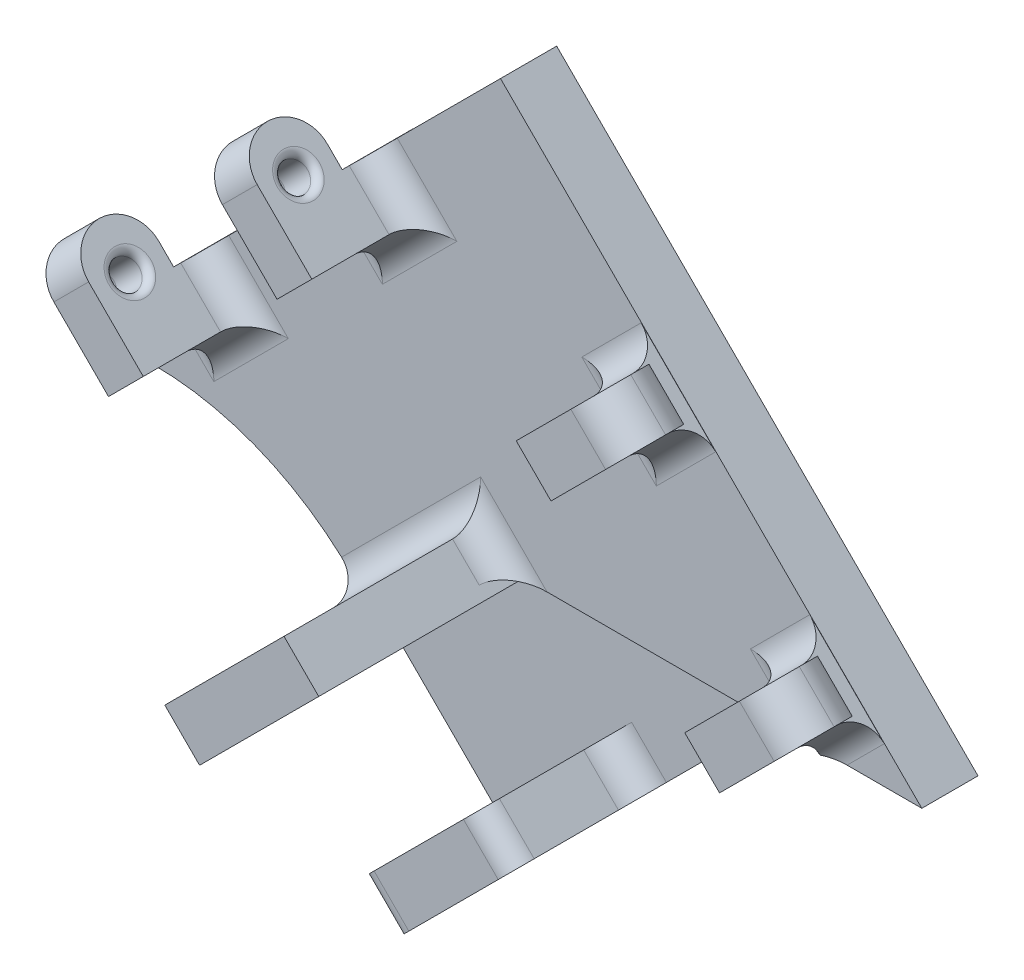
from build123d import *

# Parameters (mm, degrees)
BOSS_EXTRUDE1_DEPTH   = 4
BOSS_EXTRUDE2_START   = -4
BOSS_EXTRUDE2_DEPTH   = 13
BOSS_EXTRUDE3_START   = 2.5
BOSS_EXTRUDE3_DEPTH   = 5
BOSS_EXTRUDE3_2_DEPTH = 5
BOSS_EXTRUDE3_3_DEPTH = 5
BOSS_EXTRUDE3_4_DEPTH = 5
BOSS_EXTRUDE4_DEPTH   = 10
SKETCH6_R             = 1
CUT_EXTRUDE5_DEPTH    = 25
SKETCH7_R             = 1
CUT_EXTRUDE6_DEPTH    = 25
FILLET2_R             = 2.5
CUT_EXTRUDE8_DEPTH    = 9.5
SKETCH11_R            = 1
CUT_EXTRUDE9_DEPTH    = 20
FILLET3_R             = 20
BOSS_EXTRUDE5_DEPTH   = 5
BOSS_EXTRUDE6_DEPTH   = 3.5
SKETCH15_R            = 1.9
CUT_EXTRUDE10_DEPTH   = 1
FILLET5_R             = 0.5
FILLET6_R             = 0.5
FILLET7_R             = 2
FILLET8_R             = 1.5


# Some blends are built 0.0001 mm under size
with BuildPart() as part:
    # Sketch1 → Boss-Extrude1 (new body)
    with BuildSketch(Plane.XY):
        Polygon((-30, 0), (30, 0), (0, 30), align=None)
    extrude(amount=BOSS_EXTRUDE1_DEPTH)

    # Sketch2 → Boss-Extrude2 (add)
    with BuildSketch(Plane.XY.offset(4).offset(BOSS_EXTRUDE2_START)):
        Polygon((1.414213562, -17.899494937), (-9.899494937, -6.585786438), (-1.414213562, 1.899494937), (9.899494937, -9.414213562), align=None)
    extrude(amount=BOSS_EXTRUDE2_DEPTH)



with BuildPart() as body_2:
    # Sketch5 → Boss-Extrude3 (new body)
    with BuildSketch(Plane.XY.offset(4).offset(BOSS_EXTRUDE3_START)):
        Polygon((-8.409009742, 15.934136008), (-14.065863992, 21.590990258), (-11.590990258, 24.065863992), (-5.934136008, 18.409009742), align=None)
    extrude(amount=BOSS_EXTRUDE3_DEPTH)


with BuildPart() as body_3:
    # Sketch5 → Boss-Extrude3 2 (new body)
    with BuildSketch(Plane.XY.offset(4).offset(BOSS_EXTRUDE3_START)):
        Polygon((-20.409009742, 3.934136008), (-26.065863992, 9.590990258), (-23.590990258, 12.065863992), (-17.934136008, 6.409009742), align=None)
    extrude(amount=BOSS_EXTRUDE3_2_DEPTH)


with BuildPart() as body_4:
    # Sketch5 → Boss-Extrude3 3 (new body)
    with BuildSketch(Plane.XY.offset(4).offset(BOSS_EXTRUDE3_START)):
        Polygon((8.621141777, 15.722003974), (14.277996026, 21.378858223), (16.75286976, 18.903984489), (11.096015511, 13.24713024), align=None)
    extrude(amount=BOSS_EXTRUDE3_3_DEPTH)


with BuildPart() as body_5:
    # Sketch5 → Boss-Extrude3 4 (new body)
    with BuildSketch(Plane.XY.offset(4).offset(BOSS_EXTRUDE3_START)):
        Polygon((20.621141777, 3.722003974), (26.277996026, 9.378858223), (28.75286976, 6.903984489), (23.096015511, 1.24713024), align=None)
    extrude(amount=BOSS_EXTRUDE3_4_DEPTH)


with BuildPart() as part_1:
    add(part.part)

    add(body_2.part)  # Boss-Extrude4 merges body 2

    add(body_3.part)  # Boss-Extrude4 merges body 3

    add(body_4.part)  # Boss-Extrude4 merges body 4

    add(body_5.part)  # Boss-Extrude4 merges body 5
    # Sketch8 → Boss-Extrude4 (add)
    with BuildSketch(Plane.XY.offset(11.5)):
        Polygon((-20.409009742, 3.934136008), (-17.934136008, 6.409009742), (-20.77228069, 9.247154424), (-23.247154424, 6.77228069), align=None)
        Polygon((-8.409009742, 15.934136008), (-5.934136008, 18.409009742), (-8.770090905, 21.24496464), (-11.24496464, 18.770090905), align=None)
        Polygon((8.621141777, 15.722003974), (11.096015511, 13.24713024), (13.908555635, 16.059670364), (11.433681901, 18.534544098), align=None)
        Polygon((23.096015511, 1.24713024), (20.621141777, 3.722003974), (23.433669477, 6.534531674), (25.908543211, 4.05965794), align=None)
    extrude(amount=-BOSS_EXTRUDE4_DEPTH)

    # Sketch6 → Cut-Extrude5 (cut)
    with BuildSketch(Plane(origin=(10.924442636, -10.924442636, 0), x_dir=(0.7071067811865506, 0.7071067811865446, 0), z_dir=(0.7071067811865446, -0.7071067811865506, 0))):
        with Locations((22.098203436, 9)):
            Circle(SKETCH6_R)
    extrude(amount=-CUT_EXTRUDE5_DEPTH, mode=Mode.SUBTRACT)

    # Sketch7 → Cut-Extrude6 (cut)
    with BuildSketch(Plane(origin=(-8.237436867, -8.237436867, 0), x_dir=(0, 0, 1), z_dir=(-0.7071067811865501, -0.7071067811865449, 0))):
        with Locations(Location((9, 22.098203436, 0), (0, 0, 270))):
            Circle(SKETCH7_R)
    extrude(amount=-CUT_EXTRUDE6_DEPTH, mode=Mode.SUBTRACT)

    # Fillet2
    fillet2_edges = [part_1.edges().sort_by_distance(p)[0] for p in [
        (15.515432893, 20.141421356, 11.5),
        (15.515432893, 20.141421356, 6.5),
        (27.515432893, 8.141421356, 6.5),
        (27.515432893, 8.141421356, 11.5),
        (-24.828427125, 10.828427125, 6.5),
        (-12.828427125, 22.828427125, 6.5),
        (-12.828427125, 22.828427125, 11.5),
        (-24.828427125, 10.828427125, 11.5),
    ]]
    fillet(fillet2_edges, radius=FILLET2_R - 0.0001)  # a hair under: the kernel refuses the full size

    # Sketch10 → Cut-Extrude8 (cut)
    with BuildSketch(Plane.XY.offset(13)):
        Polygon((-7.424621202, -9.060660172), (-1.060660172, -15.424621202), (7.424621202, -6.939339828), (1.060660172, -0.575378798), align=None)
    extrude(amount=-CUT_EXTRUDE8_DEPTH, mode=Mode.SUBTRACT)

    # Sketch11 → Cut-Extrude9 (cut)
    with BuildSketch(Plane(origin=(9.656854249, -9.656854249, 0), x_dir=(0, 0, -1), z_dir=(0.7071067811865464, -0.7071067811865487, 0))):
        with Locations(Location((-9, -5.656854249, 0), (0, 0, 90))):
            Circle(SKETCH11_R)
    extrude(amount=-CUT_EXTRUDE9_DEPTH, mode=Mode.SUBTRACT)

    # Fillet3
    # the kernel refuses this fillet: 20 mm, written as the material it adds along each edge
    with BuildSketch(Plane(origin=(-3.313708499, 0, 0), x_dir=(-0.7071067811865843, -0.7071067811865105, 0), z_dir=(0, 0, 1))) as fillet3_piece_1:
        with BuildLine():
            CenterArc((29.288481627, -1.004210379), FILLET3_R, 177.121938999, 47.878061001)
            Line((15.146346003, -15.146346003), (14.863503291, -15.429188716))
            Line((14.863503291, -15.429188716), (-0.282842712, -0.282842712))
            Line((-0.282842712, -0.282842712), (0, 0.4))
            ThreePointArc((0, 0.4), (4.656854249, 0.4), (8.914213036, 0.020084208))
            Line((8.914213036, 0.020084208), (9.313708499, 0))
        make_face()
    extrude(amount=4)

    # Sketch13 → Boss-Extrude5 (add)
    with BuildSketch(Plane.XY.offset(13)):
        Polygon((-1.414213562, 1.899494937), (-9.899494937, -6.585786438), (-7.424621202, -9.060660172), (1.060660172, -0.575378798), align=None)
    extrude(amount=BOSS_EXTRUDE5_DEPTH)

    # Sketch14 → Boss-Extrude6 (add)
    with BuildSketch(Plane.XY.offset(3.5)):
        Polygon((0.485281374, 0), (9.899494937, -9.414213562), (19.313708499, 0), align=None)
    extrude(amount=-BOSS_EXTRUDE6_DEPTH)

    # Sketch15 → Cut-Extrude10 (cut)
    with BuildSketch(Plane(origin=(9.656854249, -9.656854249, 0), x_dir=(0, 0, -1), z_dir=(0.7071067811865464, -0.7071067811865487, 0))):
        with Locations(Location((-9, -5.656854249, 0), (0, 0, 90))):
            Circle(SKETCH15_R)
    extrude(amount=-CUT_EXTRUDE10_DEPTH, mode=Mode.SUBTRACT)

    # Fillet5
    fillet5_edges = [part_1.edges().sort_by_distance(p)[0] for p in [
        (-3.889087297, -5.525126266, 9),
        (-6.363961031, -3.050252532, 9),
    ]]
    fillet(fillet5_edges, radius=FILLET5_R)

    # Fillet6
    fillet6_edges = [part_1.edges().sort_by_distance(p)[0] for p in [
        (11.368251622, 18.469113819, 9),
        (23.368251622, 6.469113819, 9),
        (13.843125356, 15.994240085, 9),
        (25.843125356, 3.994240085, 9),
        (-12.57033315, 20.095459415, 9),
        (-22.095459415, 10.57033315, 9),
        (-10.095459415, 22.57033315, 9),
        (-24.57033315, 8.095459415, 9),
        (2.474873734, -11.889087297, 9),
    ]]
    fillet(fillet6_edges, radius=FILLET6_R)

    # Fillet7
    # the kernel refuses this fillet: 2 mm, written as the material it adds along each edge
    with BuildSketch(Plane(origin=(20.621141777, 3.722003974, 4), x_dir=(-0.7071067811865442, 0.7071067811865509, 0), z_dir=(0.7071067811865508, 0.7071067811865442, 0))) as fillet7_piece_1:
        with BuildLine():
            CenterArc((FILLET7_R, FILLET7_R), FILLET7_R, 180, 90)
            Line((0, FILLET7_R), (0, 0))
            Line((0, 0), (FILLET7_R, 0))
        make_face()
    extrude(amount=3.977514818)
    with BuildSketch(Plane(origin=(23.096015511, 1.24713024, 4), x_dir=(-0.7071067811865508, -0.7071067811865444, 0), z_dir=(-0.7071067811865444, 0.7071067811865508, 0))) as fillet7_piece_2_section:
        with BuildLine():
            CenterArc((FILLET7_R, FILLET7_R), FILLET7_R, 180, 90)
            Line((0, FILLET7_R), (0, 0))
            Line((0, 0), (FILLET7_R, 0))
        make_face()
    fillet7_piece_2 = extrude(amount=3.5, mode=Mode.PRIVATE)
    fillet7_piece_2 = split(fillet7_piece_2, bisect_by=Plane(origin=(21.538358904, 0, 4.452946363), z_dir=(0, 1, 0)), keep=Keep.TOP, mode=Mode.PRIVATE)
    add(fillet7_piece_2)
    with BuildSketch(Plane(origin=(25.908543211, 4.05965794, 4), x_dir=(0.7071067811865442, -0.7071067811865509, 0), z_dir=(-0.7071067811865509, -0.7071067811865442, 0))) as fillet7_piece_3_section:
        with BuildLine():
            CenterArc((FILLET7_R, FILLET7_R), FILLET7_R, 180, 90)
            Line((0, FILLET7_R), (0, 0))
            Line((0, 0), (FILLET7_R, 0))
        make_face()
    fillet7_piece_3 = extrude(amount=3.977514818, mode=Mode.PRIVATE)
    fillet7_piece_3 = split(fillet7_piece_3, bisect_by=Plane(origin=(24.822542442, 0, 4.452927613), z_dir=(0, 1, 0)), keep=Keep.TOP, mode=Mode.PRIVATE)
    add(fillet7_piece_3)
    with BuildSketch(Plane(origin=(4.02081528, -3.535533906, 4), x_dir=(0, 0, 1), z_dir=(-0.7071067811865462, 0.7071067811865489, 0))) as fillet7_piece_4_section:
        with BuildLine():
            CenterArc((FILLET7_R, FILLET7_R), FILLET7_R, 180, 90)
            Line((0, FILLET7_R), (0, 0))
            Line((0, 0), (FILLET7_R, 0))
        make_face()
    fillet7_piece_4 = extrude(amount=7.686291501, mode=Mode.PRIVATE)
    fillet7_piece_4 = split(fillet7_piece_4, bisect_by=Plane(origin=(2.268861346, 0, 4.037443885), z_dir=(0, 1, 0)), keep=Keep.TOP, mode=Mode.PRIVATE)
    add(fillet7_piece_4)
    with BuildSketch(Plane(origin=(-9.899494937, -6.585786438, 4), x_dir=(0, 0, 1), z_dir=(0.7071067811865712, 0.707106781186524, 0))) as fillet7_piece_5_section:
        with BuildLine():
            CenterArc((FILLET7_R, -FILLET7_R), FILLET7_R, 90, 90)
            Line((0, -FILLET7_R), (0, 0))
            Line((0, 0), (FILLET7_R, 0))
        make_face()
    fillet7_piece_5 = extrude(amount=12, mode=Mode.PRIVATE)
    fillet7_piece_5 = fillet7_piece_5 - Plane(origin=(-24.733876437, -20, 4.452977165), x_dir=(-0.7071067811865476, -0.7071067811865476, 0), z_dir=(0, 0, -1)) * Cylinder(20, 33, mode=Mode.PRIVATE)
    add(fillet7_piece_5)
    with BuildSketch(Plane(origin=(-20.409009742, 3.934136008, 4), x_dir=(0.7071067811865449, -0.7071067811865502, 0), z_dir=(0.7071067811865502, 0.7071067811865448, 0)), Plane(origin=(-8.409009742, 15.934136008, 4), x_dir=(0.7071067811865444, -0.7071067811865508, 0), z_dir=(0.7071067811865507, 0.7071067811865444, 0)), Plane(origin=(8.621141777, 15.722003974, 4), x_dir=(-0.7071067811865503, -0.7071067811865448, 0), z_dir=(0.7071067811865448, -0.7071067811865503, 0))) as fillet7_piece_6:
        with BuildLine():
            CenterArc((FILLET7_R, -FILLET7_R), FILLET7_R, 90, 90)
            Line((0, -FILLET7_R), (0, 0))
            Line((0, 0), (FILLET7_R, 0))
        make_face()
    extrude(amount=3.5)
    with BuildSketch(Plane(origin=(-23.237436867, 6.762563133, 4), x_dir=(-0.7071067811865498, -0.7071067811865454, 0), z_dir=(0.7071067811865452, -0.7071067811865498, 0)), Plane(origin=(-17.934136008, 6.409009742, 4), x_dir=(0.7071067811865507, 0.7071067811865445, 0), z_dir=(-0.7071067811865445, 0.7071067811865507, 0)), Plane(origin=(-11.237436867, 18.762563133, 4), x_dir=(-0.7071067811865507, -0.7071067811865445, 0), z_dir=(0.7071067811865445, -0.7071067811865507, 0)), Plane(origin=(-5.934136008, 18.409009742, 4), x_dir=(0.7071067811865506, 0.7071067811865446, 0), z_dir=(-0.7071067811865446, 0.7071067811865506, 0))) as fillet7_piece_7:
        with BuildLine():
            CenterArc((FILLET7_R, -FILLET7_R), FILLET7_R, 90, 90)
            Line((0, -FILLET7_R), (0, 0))
            Line((0, 0), (FILLET7_R, 0))
        make_face()
    extrude(amount=4)
    with BuildSketch(Plane(origin=(7.424621202, -6.939339828, 3.5), x_dir=(0.7071067811865489, 0.7071067811865462, 0), z_dir=(0.7071067811865462, -0.7071067811865489, 0))) as fillet7_piece_8:
        with BuildLine():
            CenterArc((FILLET7_R, FILLET7_R), FILLET7_R, 180, 90)
            Line((0, FILLET7_R), (0, 0))
            Line((0, 0), (FILLET7_R, 0))
        make_face()
    extrude(amount=3.5)
    with BuildSketch(Plane(origin=(11.096015511, 13.24713024, 4), x_dir=(0.7071067811865447, -0.7071067811865505, 0), z_dir=(0.7071067811865505, 0.7071067811865447, 0)), Plane(origin=(11.433681901, 18.534544098, 4), x_dir=(-0.7071067811865447, 0.7071067811865505, 0), z_dir=(-0.7071067811865505, -0.7071067811865447, 0))) as fillet7_piece_9:
        with BuildLine():
            CenterArc((FILLET7_R, -FILLET7_R), FILLET7_R, 90, 90)
            Line((0, -FILLET7_R), (0, 0))
            Line((0, 0), (FILLET7_R, 0))
        make_face()
    extrude(amount=3.977532388)
    with BuildSketch(Plane(origin=(17.085607871, 0.186470068, 4), x_dir=(-0.7071067811865442, 0.7071067811865509, 0), z_dir=(0.7071067811865508, 0.7071067811865442, 0))) as fillet7_piece_10a_section:
        with BuildLine():
            CenterArc((FILLET7_R, FILLET7_R), FILLET7_R, 180, 90)
            Line((0, FILLET7_R), (0, 0))
            Line((0, 0), (FILLET7_R, 0))
        make_face()
    fillet7_piece_10a = extrude(amount=8.977514818, mode=Mode.PRIVATE)
    fillet7_piece_10a = split(fillet7_piece_10a, bisect_by=Plane(origin=(20.300970736, 4.042175015, 4.452790229), z_dir=(-0.7071067811865508, -0.7071067811865444, 0)), keep=Keep.TOP, mode=Mode.PRIVATE)
    with BuildSketch(Plane(origin=(23.096015511, 1.24713024, 4), x_dir=(-0.7071067811865508, -0.7071067811865444, 0), z_dir=(-0.7071067811865444, 0.7071067811865508, 0))) as fillet7_piece_10b_section:
        with BuildLine():
            CenterArc((FILLET7_R, FILLET7_R), FILLET7_R, 180, 90)
            Line((0, FILLET7_R), (0, 0))
            Line((0, 0), (FILLET7_R, 0))
        make_face()
    fillet7_piece_10b = extrude(amount=8.5, mode=Mode.PRIVATE)
    fillet7_piece_10b = split(fillet7_piece_10b, bisect_by=Plane(origin=(20.300970736, 3.401832933, 4.452790229), z_dir=(-0.7071067811865442, 0.7071067811865508, 0)), keep=Keep.TOP, mode=Mode.PRIVATE)
    fillet7_piece_10 = fillet7_piece_10a & fillet7_piece_10b
    add(fillet7_piece_10)
    with BuildSketch(Plane(origin=(25.908543211, 4.05965794, 4), x_dir=(0.7071067811865442, -0.7071067811865509, 0), z_dir=(-0.7071067811865509, -0.7071067811865442, 0))) as fillet7_piece_11a_section:
        with BuildLine():
            CenterArc((FILLET7_R, FILLET7_R), FILLET7_R, 180, 90)
            Line((0, FILLET7_R), (0, 0))
            Line((0, 0), (FILLET7_R, 0))
        make_face()
    fillet7_piece_11a = extrude(amount=8.977514818, mode=Mode.PRIVATE)
    fillet7_piece_11a = split(fillet7_piece_11a, bisect_by=Plane(origin=(22.803795324, 0, 4.536078457), z_dir=(0, 1, 0)), keep=Keep.TOP, mode=Mode.PRIVATE)
    fillet7_piece_11a = split(fillet7_piece_11a, bisect_by=Plane(origin=(23.316912133, 1.026233618, 4.536078457), z_dir=(-0.7071067811865508, -0.7071067811865444, 0)), keep=Keep.TOP, mode=Mode.PRIVATE)
    with BuildSketch(Plane(origin=(26.631549417, -2.288403666, 4), x_dir=(-0.7071067811865507, -0.7071067811865442, 0), z_dir=(-0.7071067811865444, 0.7071067811865508, 0))) as fillet7_piece_11b_section:
        with BuildLine():
            CenterArc((FILLET7_R, FILLET7_R), FILLET7_R, 180, 90)
            Line((0, FILLET7_R), (0, 0))
            Line((0, 0), (FILLET7_R, 0))
        make_face()
    fillet7_piece_11b = extrude(amount=8.5, mode=Mode.PRIVATE)
    fillet7_piece_11b = split(fillet7_piece_11b, bisect_by=Plane(origin=(23.388235698, 0, 4.536078457), z_dir=(0, 1, 0)), keep=Keep.TOP, mode=Mode.PRIVATE)
    fillet7_piece_11b = split(fillet7_piece_11b, bisect_by=Plane(origin=(22.875118889, 1.026233618, 4.536078457), z_dir=(0.7071067811865442, -0.7071067811865509, 0)), keep=Keep.TOP, mode=Mode.PRIVATE)
    fillet7_piece_11 = fillet7_piece_11a & fillet7_piece_11b
    add(fillet7_piece_11)
    with BuildSketch(Plane(origin=(-9.899494937, -6.585786438, 4), x_dir=(0, 0, 1), z_dir=(0.7071067811865712, 0.707106781186524, 0))) as fillet7_piece_12a_section:
        with BuildLine():
            CenterArc((FILLET7_R, -FILLET7_R), FILLET7_R, 90, 90)
            Line((0, -FILLET7_R), (0, 0))
            Line((0, 0), (FILLET7_R, 0))
        make_face()
    fillet7_piece_12a = extrude(amount=17, mode=Mode.PRIVATE)
    fillet7_piece_12a = split(fillet7_piece_12a, bisect_by=Plane(origin=(-1.734384603, 2.219665978, 4.452790229), z_dir=(0.7071067811865489, 0.7071067811865462, 0)), keep=Keep.TOP, mode=Mode.PRIVATE)
    with BuildSketch(Plane(origin=(4.02081528, -3.535533906, 4), x_dir=(0, 0, 1), z_dir=(-0.7071067811865462, 0.7071067811865489, 0))) as fillet7_piece_12b_section:
        with BuildLine():
            CenterArc((FILLET7_R, FILLET7_R), FILLET7_R, 180, 90)
            Line((0, FILLET7_R), (0, 0))
            Line((0, 0), (FILLET7_R, 0))
        make_face()
    fillet7_piece_12b = extrude(amount=12.686291501, mode=Mode.PRIVATE)
    fillet7_piece_12b = split(fillet7_piece_12b, bisect_by=Plane(origin=(-1.094042521, 2.219665978, 4.452790229), z_dir=(-0.7071067811865461, 0.707106781186549, 0)), keep=Keep.TOP, mode=Mode.PRIVATE)
    fillet7_piece_12 = fillet7_piece_12a & fillet7_piece_12b
    add(fillet7_piece_12)
    with BuildSketch(Plane(origin=(-23.237436867, 6.762563133, 4), x_dir=(-0.7071067811865498, -0.7071067811865454, 0), z_dir=(0.7071067811865452, -0.7071067811865498, 0))) as fillet7_piece_13a_section:
        with BuildLine():
            CenterArc((FILLET7_R, -FILLET7_R), FILLET7_R, 90, 90)
            Line((0, -FILLET7_R), (0, 0))
            Line((0, 0), (FILLET7_R, 0))
        make_face()
    fillet7_piece_13a = extrude(amount=9, mode=Mode.PRIVATE)
    fillet7_piece_13a = split(fillet7_piece_13a, bisect_by=Plane(origin=(-20.729180783, 3.613964967, 4.452790229), z_dir=(0.7071067811865448, -0.7071067811865502, 0)), keep=Keep.TOP, mode=Mode.PRIVATE)
    with BuildSketch(Plane(origin=(-23.944543648, 0.398602102, 4), x_dir=(0.7071067811865449, -0.7071067811865502, 0), z_dir=(0.7071067811865502, 0.7071067811865448, 0))) as fillet7_piece_13b_section:
        with BuildLine():
            CenterArc((FILLET7_R, -FILLET7_R), FILLET7_R, 90, 90)
            Line((0, -FILLET7_R), (0, 0))
            Line((0, 0), (FILLET7_R, 0))
        make_face()
    fillet7_piece_13b = extrude(amount=8.5, mode=Mode.PRIVATE)
    fillet7_piece_13b = fillet7_piece_13b - Plane(origin=(-24.733876437, -20, 4.460562429), x_dir=(-0.7071067811865476, -0.7071067811865476, 0), z_dir=(0, 0, -1)) * Cylinder(20, 25, mode=Mode.PRIVATE)
    fillet7_piece_13b = split(fillet7_piece_13b, bisect_by=Plane(origin=(-20.100530502, 3.625656768, 4.460562429), z_dir=(-0.7071067811865498, -0.7071067811865452, 0)), keep=Keep.TOP, mode=Mode.PRIVATE)
    fillet7_piece_13 = fillet7_piece_13a & fillet7_piece_13b
    add(fillet7_piece_13)
    with BuildSketch(Plane(origin=(-20.409009742, 3.934136008, 4), x_dir=(0.7071067811865449, -0.7071067811865502, 0), z_dir=(0.7071067811865502, 0.7071067811865448, 0))) as fillet7_piece_14a_section:
        with BuildLine():
            CenterArc((FILLET7_R, -FILLET7_R), FILLET7_R, 90, 90)
            Line((0, -FILLET7_R), (0, 0))
            Line((0, 0), (FILLET7_R, 0))
        make_face()
    fillet7_piece_14a = extrude(amount=8.5, mode=Mode.PRIVATE)
    fillet7_piece_14a = split(fillet7_piece_14a, bisect_by=Plane(origin=(-17.613964967, 6.088838701, 4.452790229), z_dir=(0.7071067811865507, 0.7071067811865445, 0)), keep=Keep.TOP, mode=Mode.PRIVATE)
    with BuildSketch(Plane(origin=(-14.398602102, 2.873475836, 4), x_dir=(0.7071067811865507, 0.7071067811865445, 0), z_dir=(-0.7071067811865445, 0.7071067811865507, 0))) as fillet7_piece_14b_section:
        with BuildLine():
            CenterArc((FILLET7_R, -FILLET7_R), FILLET7_R, 90, 90)
            Line((0, -FILLET7_R), (0, 0))
            Line((0, 0), (FILLET7_R, 0))
        make_face()
    fillet7_piece_14b = extrude(amount=9, mode=Mode.PRIVATE)
    fillet7_piece_14b = split(fillet7_piece_14b, bisect_by=Plane(origin=(-17.613964967, 6.729180783, 4.452790229), z_dir=(0.7071067811865448, -0.7071067811865502, 0)), keep=Keep.TOP, mode=Mode.PRIVATE)
    fillet7_piece_14 = fillet7_piece_14a & fillet7_piece_14b
    add(fillet7_piece_14)
    with BuildSketch(Plane(origin=(-11.237436867, 18.762563133, 4), x_dir=(-0.7071067811865507, -0.7071067811865445, 0), z_dir=(0.7071067811865445, -0.7071067811865507, 0))) as fillet7_piece_15a_section:
        with BuildLine():
            CenterArc((FILLET7_R, -FILLET7_R), FILLET7_R, 90, 90)
            Line((0, -FILLET7_R), (0, 0))
            Line((0, 0), (FILLET7_R, 0))
        make_face()
    fillet7_piece_15a = extrude(amount=9, mode=Mode.PRIVATE)
    fillet7_piece_15a = split(fillet7_piece_15a, bisect_by=Plane(origin=(-8.729180783, 15.613964967, 4.452790229), z_dir=(0.7071067811865444, -0.7071067811865507, 0)), keep=Keep.TOP, mode=Mode.PRIVATE)
    with BuildSketch(Plane(origin=(-11.944543648, 12.398602102, 4), x_dir=(0.7071067811865442, -0.7071067811865507, 0), z_dir=(0.7071067811865507, 0.7071067811865444, 0))) as fillet7_piece_15b_section:
        with BuildLine():
            CenterArc((FILLET7_R, -FILLET7_R), FILLET7_R, 90, 90)
            Line((0, -FILLET7_R), (0, 0))
            Line((0, 0), (FILLET7_R, 0))
        make_face()
    fillet7_piece_15b = extrude(amount=8.5, mode=Mode.PRIVATE)
    fillet7_piece_15b = split(fillet7_piece_15b, bisect_by=Plane(origin=(-8.088838701, 15.613964967, 4.452790229), z_dir=(-0.7071067811865507, -0.7071067811865445, 0)), keep=Keep.TOP, mode=Mode.PRIVATE)
    fillet7_piece_15 = fillet7_piece_15a & fillet7_piece_15b
    add(fillet7_piece_15)
    with BuildSketch(Plane(origin=(-8.409009742, 15.934136008, 4), x_dir=(0.7071067811865444, -0.7071067811865508, 0), z_dir=(0.7071067811865507, 0.7071067811865444, 0))) as fillet7_piece_16a_section:
        with BuildLine():
            CenterArc((FILLET7_R, -FILLET7_R), FILLET7_R, 90, 90)
            Line((0, -FILLET7_R), (0, 0))
            Line((0, 0), (FILLET7_R, 0))
        make_face()
    fillet7_piece_16a = extrude(amount=8.5, mode=Mode.PRIVATE)
    fillet7_piece_16a = split(fillet7_piece_16a, bisect_by=Plane(origin=(-5.613964967, 18.088838701, 4.452790229), z_dir=(0.7071067811865506, 0.7071067811865446, 0)), keep=Keep.TOP, mode=Mode.PRIVATE)
    with BuildSketch(Plane(origin=(-2.398602102, 14.873475836, 4), x_dir=(0.7071067811865505, 0.7071067811865445, 0), z_dir=(-0.7071067811865446, 0.7071067811865506, 0))) as fillet7_piece_16b_section:
        with BuildLine():
            CenterArc((FILLET7_R, -FILLET7_R), FILLET7_R, 90, 90)
            Line((0, -FILLET7_R), (0, 0))
            Line((0, 0), (FILLET7_R, 0))
        make_face()
    fillet7_piece_16b = extrude(amount=9, mode=Mode.PRIVATE)
    fillet7_piece_16b = split(fillet7_piece_16b, bisect_by=Plane(origin=(-5.613964967, 18.729180783, 4.452790229), z_dir=(0.7071067811865444, -0.7071067811865507, 0)), keep=Keep.TOP, mode=Mode.PRIVATE)
    fillet7_piece_16 = fillet7_piece_16a & fillet7_piece_16b
    add(fillet7_piece_16)
    with BuildSketch(Plane(origin=(11.433681901, 18.534544098, 4), x_dir=(-0.7071067811865447, 0.7071067811865505, 0), z_dir=(-0.7071067811865505, -0.7071067811865447, 0))) as fillet7_piece_17a_section:
        with BuildLine():
            CenterArc((FILLET7_R, -FILLET7_R), FILLET7_R, 90, 90)
            Line((0, -FILLET7_R), (0, 0))
            Line((0, 0), (FILLET7_R, 0))
        make_face()
    fillet7_piece_17a = extrude(amount=8.977532388, mode=Mode.PRIVATE)
    fillet7_piece_17a = split(fillet7_piece_17a, bisect_by=Plane(origin=(8.300970736, 16.042175015, 4.452790229), z_dir=(-0.7071067811865503, -0.7071067811865448, 0)), keep=Keep.TOP, mode=Mode.PRIVATE)
    with BuildSketch(Plane(origin=(5.085607871, 19.25753788, 4), x_dir=(-0.7071067811865503, -0.7071067811865448, 0), z_dir=(0.7071067811865448, -0.7071067811865503, 0))) as fillet7_piece_17b_section:
        with BuildLine():
            CenterArc((FILLET7_R, -FILLET7_R), FILLET7_R, 90, 90)
            Line((0, -FILLET7_R), (0, 0))
            Line((0, 0), (FILLET7_R, 0))
        make_face()
    fillet7_piece_17b = extrude(amount=8.5, mode=Mode.PRIVATE)
    fillet7_piece_17b = split(fillet7_piece_17b, bisect_by=Plane(origin=(8.300970736, 15.401832933, 4.452790229), z_dir=(-0.7071067811865447, 0.7071067811865505, 0)), keep=Keep.TOP, mode=Mode.PRIVATE)
    fillet7_piece_17 = fillet7_piece_17a & fillet7_piece_17b
    add(fillet7_piece_17)
    with BuildSketch(Plane(origin=(8.621141777, 15.722003974, 4), x_dir=(-0.7071067811865503, -0.7071067811865448, 0), z_dir=(0.7071067811865448, -0.7071067811865503, 0))) as fillet7_piece_18a_section:
        with BuildLine():
            CenterArc((FILLET7_R, -FILLET7_R), FILLET7_R, 90, 90)
            Line((0, -FILLET7_R), (0, 0))
            Line((0, 0), (FILLET7_R, 0))
        make_face()
    fillet7_piece_18a = extrude(amount=8.5, mode=Mode.PRIVATE)
    fillet7_piece_18a = split(fillet7_piece_18a, bisect_by=Plane(origin=(10.77584447, 12.926959199, 4.452790229), z_dir=(0.7071067811865447, -0.7071067811865505, 0)), keep=Keep.TOP, mode=Mode.PRIVATE)
    with BuildSketch(Plane(origin=(7.560481605, 9.711596334, 4), x_dir=(0.7071067811865447, -0.7071067811865505, 0), z_dir=(0.7071067811865505, 0.7071067811865447, 0))) as fillet7_piece_18b_section:
        with BuildLine():
            CenterArc((FILLET7_R, -FILLET7_R), FILLET7_R, 90, 90)
            Line((0, -FILLET7_R), (0, 0))
            Line((0, 0), (FILLET7_R, 0))
        make_face()
    fillet7_piece_18b = extrude(amount=8.977532388, mode=Mode.PRIVATE)
    fillet7_piece_18b = split(fillet7_piece_18b, bisect_by=Plane(origin=(11.416186552, 12.926959199, 4.452790229), z_dir=(-0.7071067811865503, -0.7071067811865448, 0)), keep=Keep.TOP, mode=Mode.PRIVATE)
    fillet7_piece_18 = fillet7_piece_18a & fillet7_piece_18b
    add(fillet7_piece_18)

    # Fillet8
    fillet8_edges = [part_1.edges().sort_by_distance(p)[0] for p in [
        (8.66205807, -8.176776695, 13),
        (0.176776695, -16.66205807, 13),
    ]]
    fillet(fillet8_edges, radius=FILLET8_R)


solid = part_1.part
